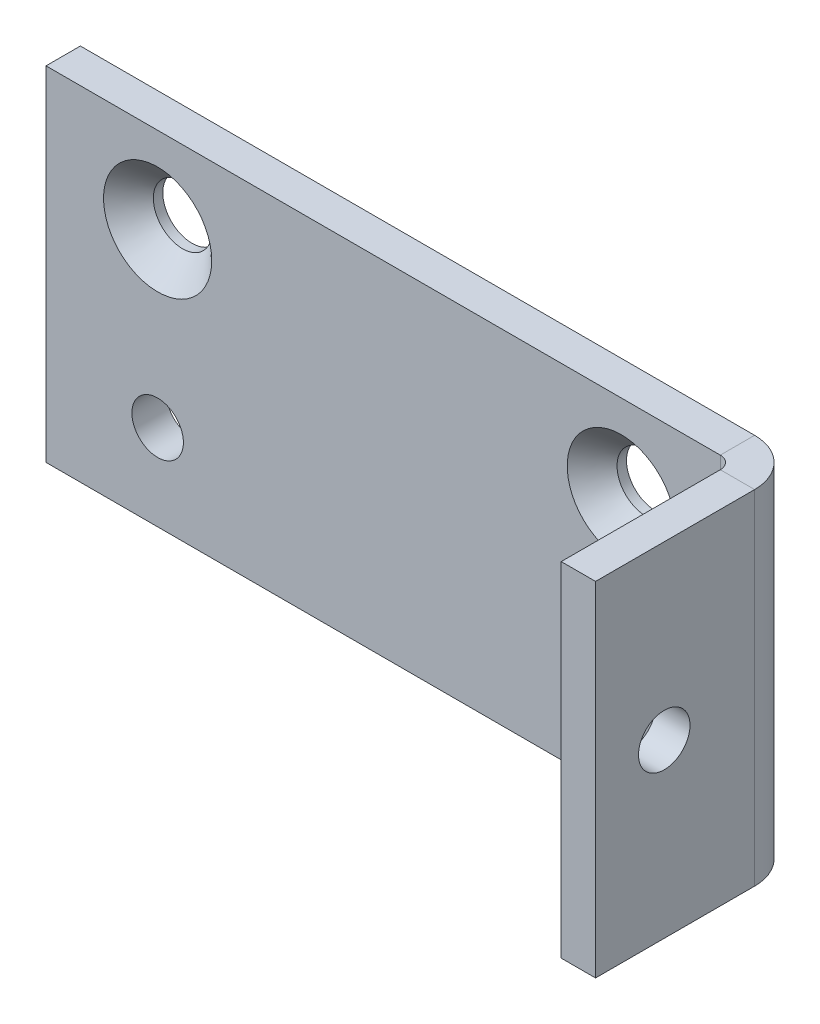
from build123d import *

# Parameters (mm, degrees)
SKETCH_1_W                       = 40
SKETCH_1_H                       = 20
SM_BASE_FLANGE_1_DEPTH           = 2
SM_EDGE_FLANGE_1_STRIP_W         = 9.4732
SM_EDGE_FLANGE_1_STRIP_H         = 2
SM_EDGE_FLANGE_1_STRIP_CUT_DEPTH = 20
SM_EDGE_FLANGE_1_DEPTH           = 20
HOLE_WIZARD_M3_2_AT_2_COUNT      = 2
HOLE_WIZARD_M3_2_AT_2_PITCH      = 27
HOLE_WIZARD_M3_1_D               = 3
HOLE_WIZARD_M3_2_2_D             = 3


# Sheet-metal steps are written as plain solids
with BuildPart() as part:
    # Sketch 1 → 基材-凸緣1 (new body)
    with BuildSketch(Plane.XY):
        Rectangle(SKETCH_1_W, SKETCH_1_H)
    extrude(amount=-SM_BASE_FLANGE_1_DEPTH)

    # 邊線-凸緣1 strip (across the edge) → 邊線-凸緣1 strip cut (cut)
    with BuildSketch(Plane(origin=(20, -10, 0), x_dir=(-1, 0, 0), z_dir=(0, 1, 0))):
        with Locations((-4, -1)):
            Rectangle(SM_EDGE_FLANGE_1_STRIP_W, SM_EDGE_FLANGE_1_STRIP_H)
    extrude(amount=SM_EDGE_FLANGE_1_STRIP_CUT_DEPTH, mode=Mode.SUBTRACT)

    # 邊線-凸緣1 section (across the edge) → 邊線-凸緣1 (add)
    with BuildSketch(Plane(origin=(20, -10, 0), x_dir=(-1, 0, 0), z_dir=(0, 1, 0))):
        with BuildLine():
            Line((-2, 0.7366), (-2, 10))
            Line((-2, 10), (0, 10))
            Line((0, 10), (0, 0.7366))
            ThreePointArc((0, 0.7366), (0.215745145, 0.215745145), (0.7366, 0))
            Line((0.7366, 0), (0.7366, -2))
            ThreePointArc((0.7366, -2), (-1.198468417, -1.198468417), (-2, 0.7366))
        make_face()
    extrude(amount=SM_EDGE_FLANGE_1_DEPTH)

    # 草圖11 → Hole Wizard M3 _2 (revolve, cut)
    with BuildSketch(Plane(origin=(-13.5, 5, 0), x_dir=(0, -1, 0), z_dir=(1, 0, 0))):
        Polygon((0, 0), (0, 2), (1.7, 2), (1.7, 1.45), (3.15, 0), align=None)
    hole_wizard_m3_2 = revolve(axis=Axis((-13.5, 5, 6.35), (0, 0, -1)), mode=Mode.SUBTRACT)

    # Hole Wizard M3 _2 at 2: Hole Wizard M3 _2 ×2
    with Locations(*[(i * HOLE_WIZARD_M3_2_AT_2_PITCH, 0, 0) for i in range(1, HOLE_WIZARD_M3_2_AT_2_COUNT)]):
        add(hole_wizard_m3_2, mode=Mode.SUBTRACT)

    # M3 螺紋孔1 (through all)
    with Locations(Plane(origin=(22, 0, 0), x_dir=(0, 0, -1), z_dir=(1, 0, 0))):
        with Locations((-6, 0)):
            Hole(HOLE_WIZARD_M3_1_D / 2)

    # Hole Wizard M3 _2 2 (through all)
    with Locations(Plane(origin=(0, 0, -2), x_dir=(-1, 0, 0), z_dir=(0, 0, -1))):
        with Locations((-13.5, -5), (13.5, -5)):
            Hole(HOLE_WIZARD_M3_2_2_D / 2)


solid = part.part
